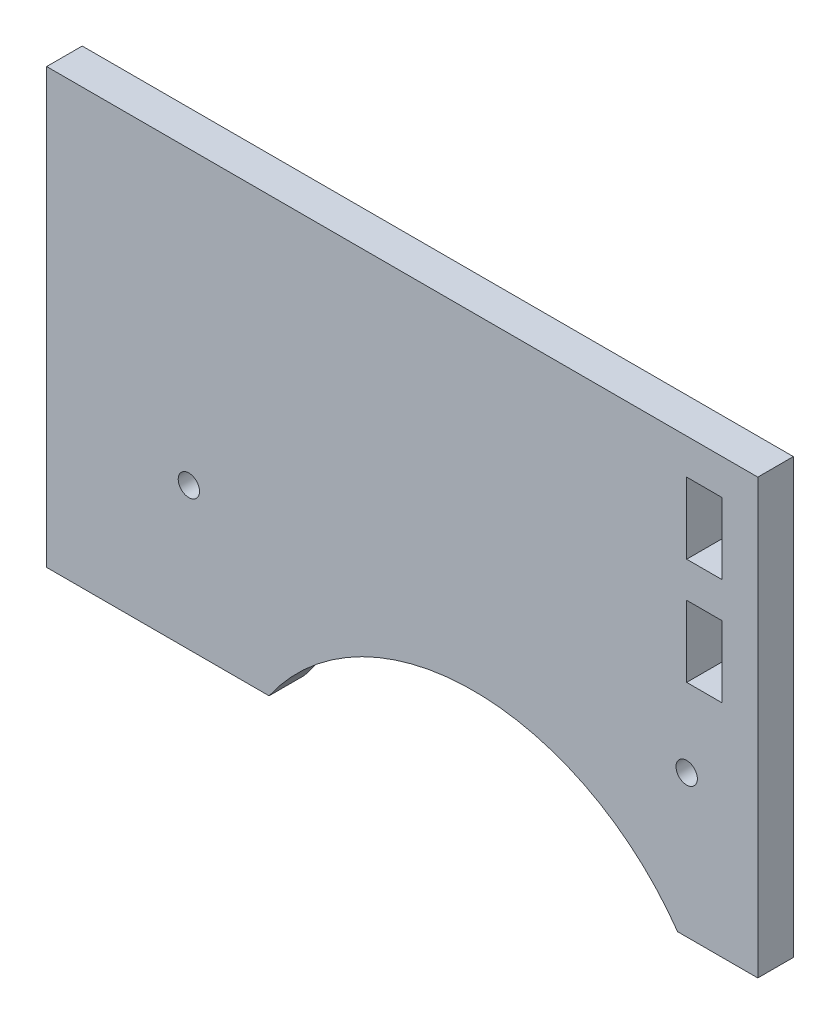
from build123d import *

# Parameters (mm, degrees)
ESQUISSE1_R        = 1.5
ESQUISSE1_W        = 5
ESQUISSE1_H        = 10
BOSS_EXTRU_1_DEPTH = 5


with BuildPart() as part:
    # Esquisse1 → Boss.-Extru.1 (new body)
    with BuildSketch(Plane.XY):
        with BuildLine():
            Line((0, 0), (31.277186767, 0))
            ThreePointArc((31.277186767, 0), (60, 15), (88.722813233, 0))
            Line((88.722813233, 0), (100, 0))
            Line((100, 0), (100, 61))
            Line((100, 61), (0, 61))
            Line((0, 61), (0, 0))
        make_face()
        with Locations((20, 20)):
            Circle(ESQUISSE1_R, mode=Mode.SUBTRACT)
        with Locations((90, 20)):
            Circle(ESQUISSE1_R, mode=Mode.SUBTRACT)
        with Locations((92.5, 51)):
            Rectangle(ESQUISSE1_W, ESQUISSE1_H, mode=Mode.SUBTRACT)
        with Locations((92.5, 36)):
            Rectangle(ESQUISSE1_W, ESQUISSE1_H, mode=Mode.SUBTRACT)
    extrude(amount=BOSS_EXTRU_1_DEPTH)


solid = part.part
